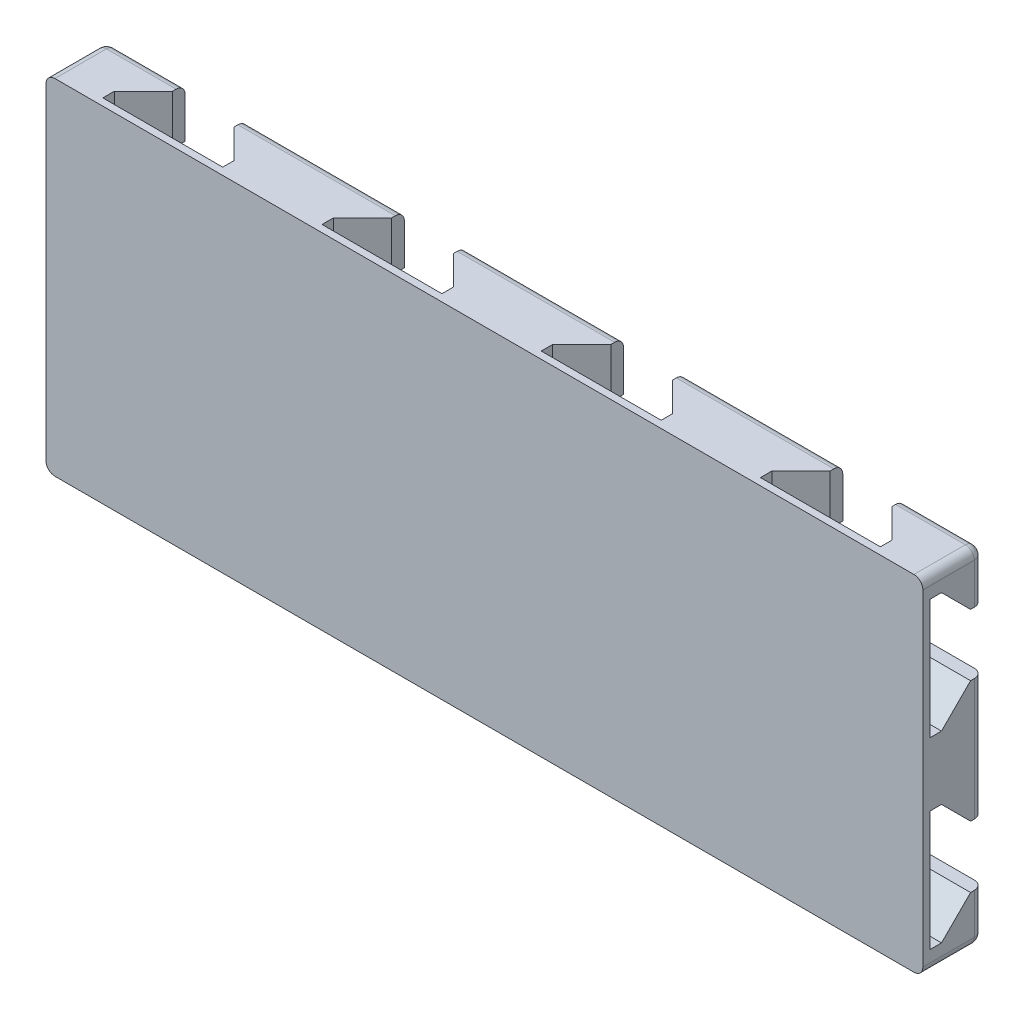
from build123d import *

# Parameters (mm, degrees)
SKETCH1_W           = 77
SKETCH1_H           = 196
BOSS_EXTRUDE1_DEPTH = 13.5
CUT_EXTRUDE1_DEPTH  = 201.201148848
CUT_EXTRUDE2_DEPTH  = 126.360480216
FILLET1_R           = 2


with BuildPart() as part:
    # Sketch1 → Boss-Extrude1 (new body)
    with BuildSketch(Plane(origin=(0, 0, 0), x_dir=(0, 1, 0), z_dir=(0, 0, 1))):
        Rectangle(SKETCH1_W, SKETCH1_H)
    extrude(amount=BOSS_EXTRUDE1_DEPTH)

    # Sketch2 → Cut-Extrude1 (cut, through all)
    with BuildSketch(Plane(origin=(-98, 0, 0), x_dir=(0, -1, 0), z_dir=(-1, 0, 0))):
        Polygon((-27.4, 2.834314575), (-27.4, 0), (-13.6, 0), (-13.6, 2.834314575), (-7.1, 9.334314575), (-7.1, 11.9), (-33.9, 11.9), (-33.9, 9.334314575), align=None)
        Polygon((13.6, 2.834314575), (13.6, 0), (27.4, 0), (27.4, 2.834314575), (33.9, 9.334314575), (33.9, 11.9), (7.1, 11.9), (7.1, 9.334314575), align=None)
    extrude(amount=-CUT_EXTRUDE1_DEPTH, mode=Mode.SUBTRACT)

    # Sketch3 → Cut-Extrude2 (cut, through all)
    with BuildSketch(Plane.XZ.offset(38.5)):
        Polygon((-80.4, 2.834314575), (-80.4, 0), (-66.6, 0), (-66.6, 2.834314575), (-60.1, 9.334314575), (-60.1, 11.9), (-86.9, 11.9), (-86.9, 9.334314575), align=None)
        Polygon((-31.4, 2.834314575), (-31.4, 0), (-17.6, 0), (-17.6, 2.834314575), (-11.1, 9.334314575), (-11.1, 11.9), (-37.9, 11.9), (-37.9, 9.334314575), align=None)
        Polygon((66.6, 0), (80.4, 0), (80.4, 2.834314575), (86.9, 9.334314575), (86.9, 11.9), (60.1, 11.9), (60.1, 9.334314575), (66.6, 2.834314575), align=None)
        Polygon((17.6, 2.834314575), (17.6, 0), (31.4, 0), (31.4, 2.834314575), (37.9, 9.334314575), (37.9, 11.9), (11.1, 11.9), (11.1, 9.334314575), align=None)
    extrude(amount=-CUT_EXTRUDE2_DEPTH, mode=Mode.SUBTRACT)

    # Fillet1
    fillet1_edges = [part.edges().sort_by_distance(p)[0] for p in [
        (0, 38.5, 0),
        (-49, 38.5, 0),
        (49, 38.5, 0),
        (89.2, 38.5, 0),
        (98, 38.5, 6.75),
        (98, 32.95, 0),
        (98, 0, 0),
        (98, -38.5, 6.75),
        (98, -32.95, 0),
        (89.2, -38.5, 0),
        (49, -38.5, 0),
        (0, -38.5, 0),
        (-49, -38.5, 0),
        (-98, 38.5, 6.75),
        (-89.2, 38.5, 0),
        (-98, 32.95, 0),
        (-98, 0, 0),
        (-98, -38.5, 6.75),
        (-98, -32.95, 0),
        (-89.2, -38.5, 0),
    ]]
    fillet(fillet1_edges, radius=FILLET1_R)


solid = part.part
